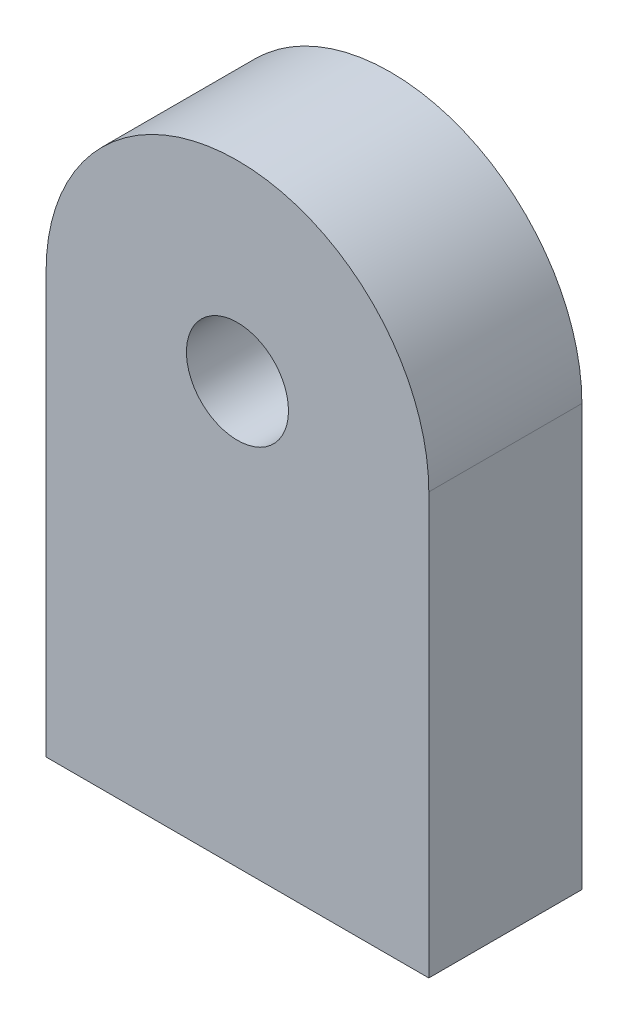
from build123d import *

# Parameters (mm, degrees)
SKETCH2_R           = 15
SKETCH2_R_2         = 11
BOSS_EXTRUDE1_DEPTH = 4
SKETCH3_R           = 15
SKETCH3_R_2         = 4
BOSS_EXTRUDE2_DEPTH = 8
BOSS_EXTRUDE5_START = -12
BOSS_EXTRUDE5_DEPTH = 12


with BuildPart() as part:
    # Sketch2 → Boss-Extrude1 (new body)
    with BuildSketch(Plane.XY):
        Circle(SKETCH2_R)
        Circle(SKETCH2_R_2, mode=Mode.SUBTRACT)
    extrude(amount=BOSS_EXTRUDE1_DEPTH)

    # Sketch3 → Boss-Extrude2 (add)
    with BuildSketch(Plane.XY.offset(4)):
        Circle(SKETCH3_R)
        Circle(SKETCH3_R_2, mode=Mode.SUBTRACT)
    extrude(amount=BOSS_EXTRUDE2_DEPTH)

    # Sketch6 → Boss-Extrude5 (add)
    with BuildSketch(Plane.XY.offset(12).offset(BOSS_EXTRUDE5_START)):
        with BuildLine():
            Line((-15, 0), (-15, -33))
            Line((-15, -33), (15, -33))
            Line((15, -33), (15, 0))
            ThreePointArc((15, 0), (0, -15), (-15, 0))
        make_face()
    extrude(amount=BOSS_EXTRUDE5_DEPTH)


solid = part.part
